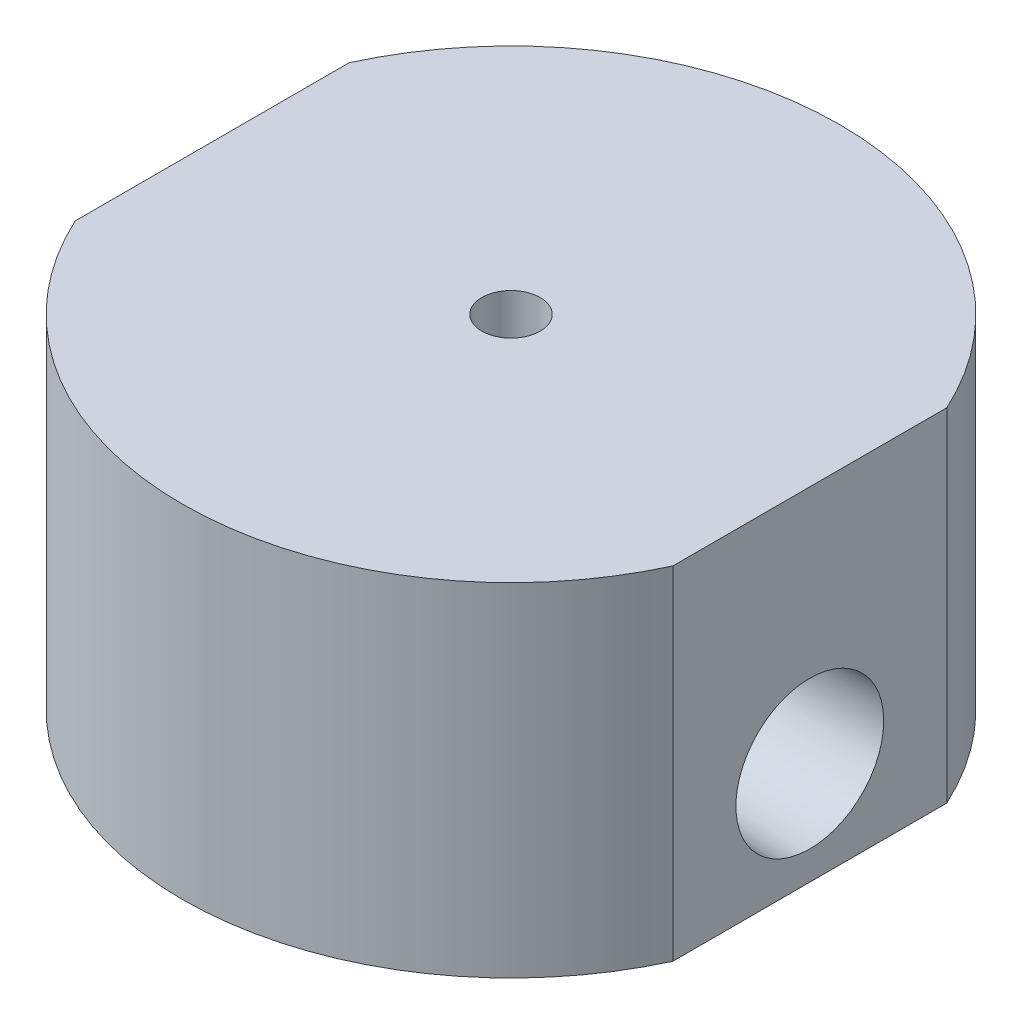
from build123d import *

# Parameters (mm, degrees)
F_1_4_28_TAPPED_HOLE1_D = 5.4102
SKETCH4_W               = 25.4
SKETCH4_H               = 25.4
FLATS_DEPTH             = 54.536186827
FILLET1_R               = 1.5875


with BuildPart() as part:
    # Sketch1 → Revolve1 (revolve)
    with BuildSketch(Plane.XY):
        with BuildLine():
            Line((0, 31.75), (-30.48, 31.75))
            Line((-30.48, 31.75), (-30.48, 0))
            Line((-30.48, 0), (-17.145, 0))
            Line((-17.145, 0), (-17.145, 19.05))
            Line((-17.145, 19.05), (-13.97, 19.05))
            ThreePointArc((-13.97, 19.05), (-7.459314312, 16.353185688), (-4.7625, 9.8425))
            Line((-4.7625, 9.8425), (0, 9.8425))
            Line((0, 9.8425), (0, 31.75))
        make_face()
    revolve(axis=Axis((0, 0, 0), (0, 1, 0)))

    # 1/4-28 Tapped Hole1 (through all)
    with Locations(Plane(origin=(0, 31.75, 0), x_dir=(1, 0, 0), z_dir=(0, 1, 0))):
        with Locations((0, 0)):
            Hole(F_1_4_28_TAPPED_HOLE1_D / 2)

    # Sketch4 → flats (cut, through all)
    with BuildSketch(Plane(origin=(0, 0, 0), x_dir=(1, 0, 0), z_dir=(0, 1, 0))):
        with Locations((-40.408128771, 0)):
            Rectangle(SKETCH4_W, SKETCH4_H)
        with Locations((40.408128771, 0)):
            Rectangle(SKETCH4_W, SKETCH4_H)
    extrude(amount=FLATS_DEPTH, mode=Mode.SUBTRACT)

    # Sketch6 → 1/4 NPT Tapped Hole1 (revolve, cut)
    with BuildSketch(Plane(origin=(27.708128771, 9.525, 0), x_dir=(0, 0, -1), z_dir=(0, 1, 0))):
        Polygon((0, 0), (0, 20.614347279), (5.5626, 17.272), (5.5626, 9.906), (6.557984794, 9.906), (6.8545837, 0), align=None)
    f_1_4_npt_tapped_hole1 = revolve(axis=Axis((34.058128771, 9.525, 0), (-1, 0, 0)), mode=Mode.SUBTRACT)

    # Mirror1: 1/4 NPT Tapped Hole1 across plane
    add(f_1_4_npt_tapped_hole1.mirror(Plane(origin=(0, 0, 0), x_dir=(0, 0, 1), z_dir=(1, 0, 0))), mode=Mode.SUBTRACT)

    # Fillet1
    fillet1_edges = [part.edges().sort_by_distance(p)[0] for p in [
        (17.145, 19.05, 0),
    ]]
    fillet(fillet1_edges, radius=FILLET1_R)


solid = part.part
